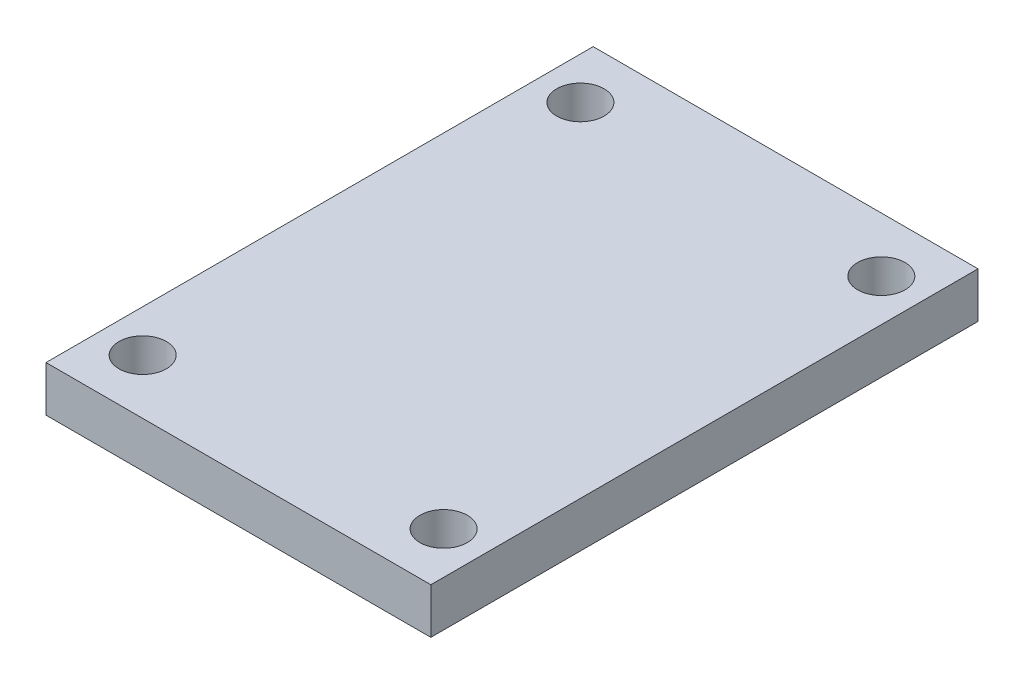
from build123d import *

# Parameters (mm, degrees)
SKETCH1_W           = 54.61
SKETCH1_H           = 76.2
BOSS_EXTRUDE1_DEPTH = 6.35
SKETCH2_R           = 3.302
CUT_EXTRUDE1_DEPTH  = 94.962836271
SKETCH3_W           = 0.508
SKETCH3_H           = 76.2
CUT_EXTRUDE2_DEPTH  = 94.962836271


with BuildPart() as part:
    # Sketch1 → Boss-Extrude1 (new body)
    with BuildSketch(Plane(origin=(0, 0, 0), x_dir=(1, 0, 0), z_dir=(0, 1, 0))):
        with Locations((-27.305, 38.1)):
            Rectangle(SKETCH1_W, SKETCH1_H)
    extrude(amount=BOSS_EXTRUDE1_DEPTH)

    # Sketch2 → Cut-Extrude1 (cut, through all)
    with BuildSketch(Plane(origin=(0, 6.35, 0), x_dir=(1, 0, 0), z_dir=(0, 1, 0))):
        with Locations((-6.35, 7.62)):
            Circle(SKETCH2_R)
        with Locations((-6.35, 68.58)):
            Circle(SKETCH2_R)
    cut_extrude1 = extrude(amount=-CUT_EXTRUDE1_DEPTH, mode=Mode.SUBTRACT)

    # Mirror1: Cut-Extrude1 across plane
    add(cut_extrude1.mirror(Plane(origin=(-27.305, 0, 0), x_dir=(0, 0, 1), z_dir=(1, 0, 0))), mode=Mode.SUBTRACT)

    # Sketch3 → Cut-Extrude2 (cut, through all)
    with BuildSketch(Plane(origin=(0, 6.35, 0), x_dir=(1, 0, 0), z_dir=(0, 1, 0))):
        with Locations((-0.254, 38.1)):
            Rectangle(SKETCH3_W, SKETCH3_H)
    cut_extrude2 = extrude(amount=-CUT_EXTRUDE2_DEPTH, mode=Mode.SUBTRACT)

    # Mirror2: Cut-Extrude2 across plane
    add(cut_extrude2.mirror(Plane(origin=(-27.305, 0, 0), x_dir=(0, 0, 1), z_dir=(1, 0, 0))), mode=Mode.SUBTRACT)


solid = part.part
